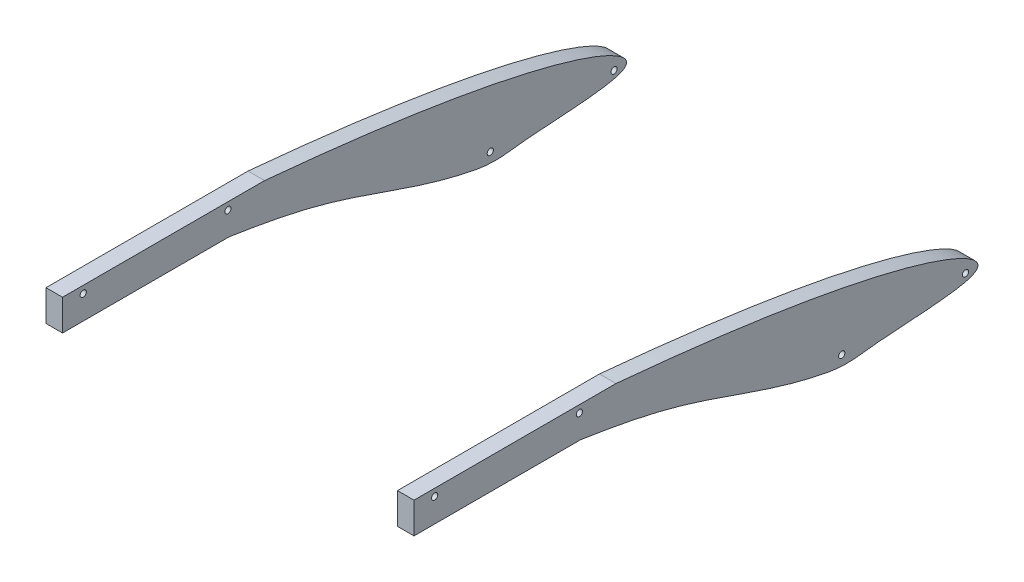
from build123d import *

# Parameters (mm, degrees)
BOSS_EXTRUDE1_START     = -8
BOSS_EXTRUDE1_DEPTH     = 16
CUT_EXTRUDE1_DEPTH      = 357.850215718
CUT_EXTRUDE1_DEPTH_BACK = 357.850215718
SKETCH3_R               = 3


# Read off the part's stored shape, not the designer's step: Boss-Extrude1
with BuildPart() as part:
    # Boss-Extrude1 outline → Boss-Extrude1 (new body)
    with BuildSketch(Plane.ZY.offset(170).offset(BOSS_EXTRUDE1_START)):
        with BuildLine():
            Line((240, 154), (240, 184))
            Line((240, 184), (44.580705645, 184))
            add(Edge.make_bspline(
                [(44.580705645, 184), (-57.767979852, 174.527100953), (-305.521879125, 149.248640345), (-306.889667667, 116.120839414), (-325.983667032, 107.106894681), (-312.443719399, 102.442751763), (-318.80884118, 94.810587603), (-234.776346203, 96.05757536), (-193.159902981, 90.143019518)],
                knots=[0, 0, 0, 0, 0, 0, 0, 0, 0, 1, 1, 1, 1, 1, 1, 1, 1, 1], degree=8))
            ThreePointArc((-193.159902981, 90.143019518), (-177.100635592, 89.167925938), (-161.092843133, 90.78082926))
            add(Edge.make_bspline(
                [(-161.092843133, 90.78082926), (-92.518943208, 103.326483389), (-43.151690065, 130.858776096), (-1.805394367, 141.508864751), (78.779942876, 154)],
                knots=[0, 0, 0, 0, 0, 1, 1, 1, 1, 1], degree=4))
            Line((78.779942876, 154), (240, 154))
        make_face()
    extrude(amount=BOSS_EXTRUDE1_DEPTH)

    # Sketch3 → Cut-Extrude1 (cut, two sides: drawn at the far end of the back side and taken through both)
    with BuildSketch(Plane.ZY.offset(170).offset(-CUT_EXTRUDE1_DEPTH_BACK)):
        with Locations((-293.546030237, 107.310137802)):
            Circle(SKETCH3_R)
        with Locations((-173.838344205, 98.939360953)):
            Circle(SKETCH3_R)
        with Locations((220, 177)):
            Circle(SKETCH3_R)
        with Locations((80, 177)):
            Circle(SKETCH3_R)
    extrude(amount=CUT_EXTRUDE1_DEPTH + CUT_EXTRUDE1_DEPTH_BACK, mode=Mode.SUBTRACT)


with BuildPart() as body_2:
    # Mirror2: mirrored copy
    add(part.part.mirror(Plane(origin=(0, 0, 0), x_dir=(0, 0, 1), z_dir=(1, 0, 0))))


solid = Compound([part.part, body_2.part])
